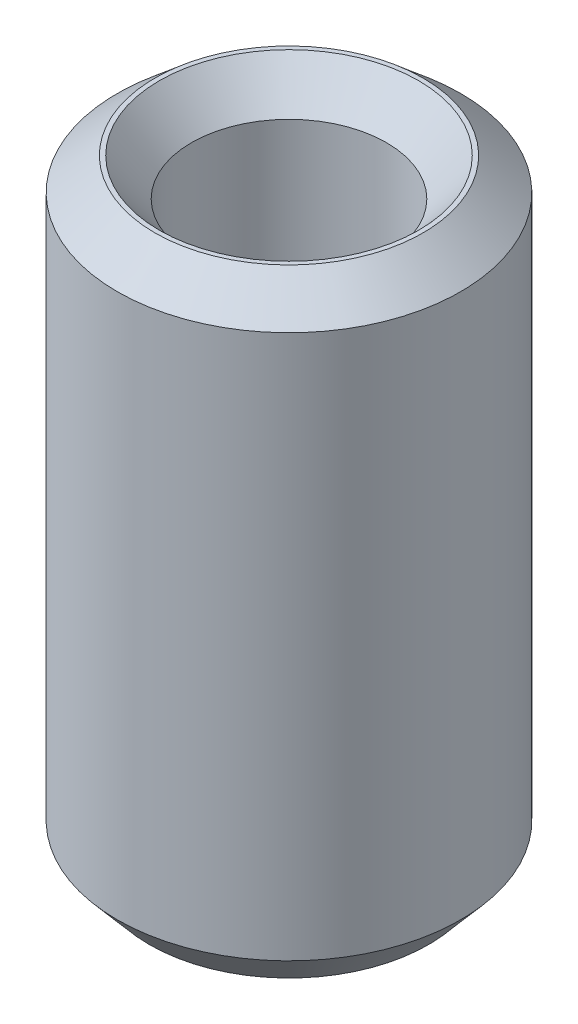
from build123d import *
from OCP.BRepFilletAPI import BRepFilletAPI_MakeChamfer

# Parameters (mm, degrees)
SKETCH1_R           = 15
BOSS_EXTRUDE1_DEPTH = 53.610307247
SKETCH2_R           = 8.51542347
CUT_EXTRUDE1_DEPTH  = 58.654705299
CHAMFER1_SIZE       = 2.806100918
CHAMFER1_SIZE2      = 3.284867177


with BuildPart() as part:
    # Sketch1 → Boss-Extrude1 (new body)
    with BuildSketch(Plane(origin=(0, 0, 0), x_dir=(1, 0, 0), z_dir=(0, 1, 0))):
        Circle(SKETCH1_R)
    extrude(amount=BOSS_EXTRUDE1_DEPTH)

    # Sketch2 → Cut-Extrude1 (cut, through all)
    with BuildSketch(Plane(origin=(0, 0, 0), x_dir=(1, 0, 0), z_dir=(0, 1, 0))):
        Circle(SKETCH2_R)
    extrude(amount=CUT_EXTRUDE1_DEPTH, mode=Mode.SUBTRACT)

    # Chamfer1: one chamfer whose edges measure the first distance from different faces: ONE call of the kernel's chamfer builder (chamfer() names one face for all edges)
    chamfer1_edges_1 = [part.edges().sort_by_distance(p)[0] for p in [
        (-8.51542347, 53.610307247, 0),
    ]]
    chamfer1_side_1 = [part.faces().sort_by_distance(p)[0] for p in [
        (-14.575735931, 53.610307247, 0),
    ]]
    chamfer1_edges_2 = [part.edges().sort_by_distance(p)[0] for p in [
        (-8.51542347, 0, 0),
    ]]
    chamfer1_side_2 = [part.faces().sort_by_distance(p)[0] for p in [
        (-8.51542347, 26.805153623, 0),
    ]]
    chamfer1_edges_3 = [part.edges().sort_by_distance(p)[0] for p in [
        (-15, 0, 0),
    ]]
    chamfer1_side_3 = [part.faces().sort_by_distance(p)[0] for p in [
        (-14.575735931, 0, 0),
    ]]
    chamfer1_edges_4 = [part.edges().sort_by_distance(p)[0] for p in [
        (-15, 53.610307247, 0),
    ]]
    chamfer1_side_4 = [part.faces().sort_by_distance(p)[0] for p in [
        (-15, 26.805153623, 0),
    ]]
    chamfer1 = BRepFilletAPI_MakeChamfer(part.part.solid().wrapped)
    for e in chamfer1_edges_1:
        chamfer1.Add(CHAMFER1_SIZE, CHAMFER1_SIZE2, e.wrapped, chamfer1_side_1[0].wrapped)  # the first distance lies on this face
    for e in chamfer1_edges_2:
        chamfer1.Add(CHAMFER1_SIZE, CHAMFER1_SIZE2, e.wrapped, chamfer1_side_2[0].wrapped)  # the first distance lies on this face
    for e in chamfer1_edges_3:
        chamfer1.Add(CHAMFER1_SIZE, CHAMFER1_SIZE2, e.wrapped, chamfer1_side_3[0].wrapped)  # the first distance lies on this face
    for e in chamfer1_edges_4:
        chamfer1.Add(CHAMFER1_SIZE, CHAMFER1_SIZE2, e.wrapped, chamfer1_side_4[0].wrapped)  # the first distance lies on this face
    add(Compound.cast(chamfer1.Shape()), mode=Mode.REPLACE)


solid = part.part
